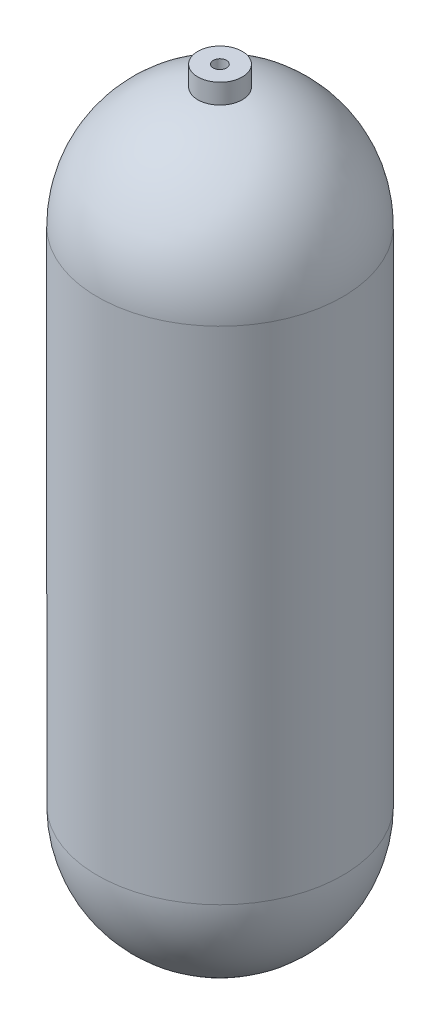
from build123d import *

# Parameters (mm, degrees)
SKETCH2_R                        = 15.875
BOSS_EXTRUDE1_DEPTH              = 12.7
BOSS_EXTRUDE1_DIRECTION_2_REACH  = 549.607
F_3_8_0_375_DIAMETER_HOLE1_D     = 9.525
F_3_8_0_375_DIAMETER_HOLE1_DEPTH = 25.4
F_3_8_0_375_DIAMETER_HOLE1_TIP   = 2.861598698118756


with BuildPart() as part:
    # Sketch1 → Revolve1 (revolve)
    with BuildSketch(Plane.XY):
        with BuildLine():
            Line((87.62999999999998, 445.77), (87.63000000000004, 87.63000000000005))
            ThreePointArc((87.63000000000004, 87.63000000000005), (61.96376723537718, 25.66623276462287), (0, 1.388e-14))
            Line((0, 1.388e-14), (-1.458e-14, 3.1750000000000114))
            ThreePointArc((-1.458e-14, 3.1750000000000114), (59.71870320510988, 27.91129679489014), (84.45500000000004, 87.63000000000004))
            Line((84.45500000000004, 87.63000000000004), (84.45499999999998, 445.77))
            ThreePointArc((84.45499999999998, 445.77), (59.71870320510986, 505.48870320510986), (5.17e-15, 530.2249999999999))
            Line((5.17e-15, 530.2249999999999), (0, 533.4000000000001))
            ThreePointArc((0, 533.4000000000001), (61.96376723537715, 507.7337672353771), (87.62999999999998, 445.77))
        make_face()
    revolve(axis=Axis((0, 533.4000000000001, 0), (0, 1, 0)))

    # Sketch2 → Boss-Extrude1 (add)
    with BuildSketch(Plane(origin=(0, 533.4000000000001, 0), x_dir=(1, 0, 0), z_dir=(0, 1, 0))):
        Circle(SKETCH2_R)
    extrude(amount=BOSS_EXTRUDE1_DEPTH)

    # Sketch2 → Boss-Extrude1 direction 2 (add, up to next)
    with BuildSketch(Plane(origin=(0, 533.4000000000001, 0), x_dir=(1, 0, 0), z_dir=(0, 1, 0)), mode=Mode.PRIVATE) as boss_extrude1_direction_2_sk1:
        Circle(SKETCH2_R)
    boss_extrude1_direction_2_tool1 = extrude(boss_extrude1_direction_2_sk1.sketch, amount=-BOSS_EXTRUDE1_DIRECTION_2_REACH, mode=Mode.PRIVATE) - part.part
    add(boss_extrude1_direction_2_tool1.solids().sort_by_distance((0, 533.4, 0))[0])

    # 3/8 (0.375) Diameter Hole1
    with Locations(Plane(origin=(-0.053238661, 546.1, 0.09377676), x_dir=(0, 0, 1), z_dir=(0, 1, 0))):
        with Locations((0, 0)):
            Hole(F_3_8_0_375_DIAMETER_HOLE1_D / 2, depth=F_3_8_0_375_DIAMETER_HOLE1_DEPTH)
            with Locations((0, 0, -(F_3_8_0_375_DIAMETER_HOLE1_DEPTH + F_3_8_0_375_DIAMETER_HOLE1_TIP / 2))):  # 118° drill point
                Cone(0, F_3_8_0_375_DIAMETER_HOLE1_D / 2, F_3_8_0_375_DIAMETER_HOLE1_TIP, mode=Mode.SUBTRACT)


solid = part.part
